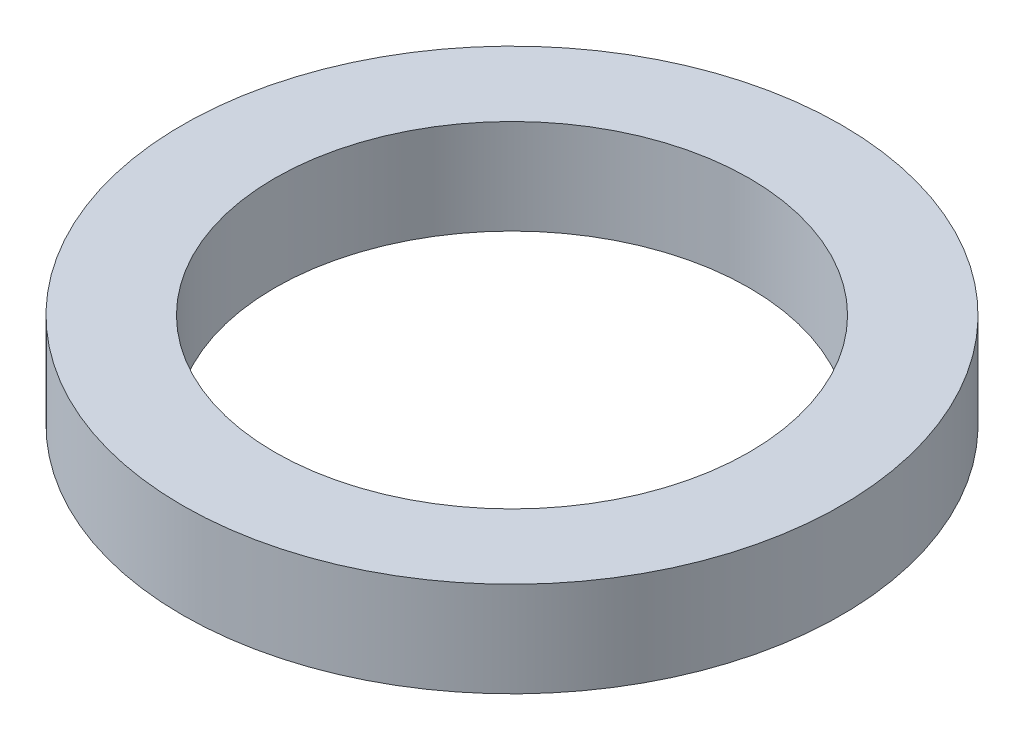
from build123d import *

# Parameters (mm, degrees)
SKETCH1_R           = 62.5
BOSS_EXTRUDE1_DEPTH = 18
SKETCH2_R           = 45
CUT_EXTRUDE1_DEPTH  = 91.202549853


with BuildPart() as part:
    # Sketch1 → Boss-Extrude1 (new body)
    with BuildSketch(Plane(origin=(0, 0, 0), x_dir=(1, 0, 0), z_dir=(0, 1, 0))):
        Circle(SKETCH1_R)
    extrude(amount=BOSS_EXTRUDE1_DEPTH)

    # Sketch2 → Cut-Extrude1 (cut, through all)
    with BuildSketch(Plane(origin=(0, 0, 0), x_dir=(1, 0, 0), z_dir=(0, 1, 0))):
        Circle(SKETCH2_R)
    extrude(amount=CUT_EXTRUDE1_DEPTH, mode=Mode.SUBTRACT)


solid = part.part
